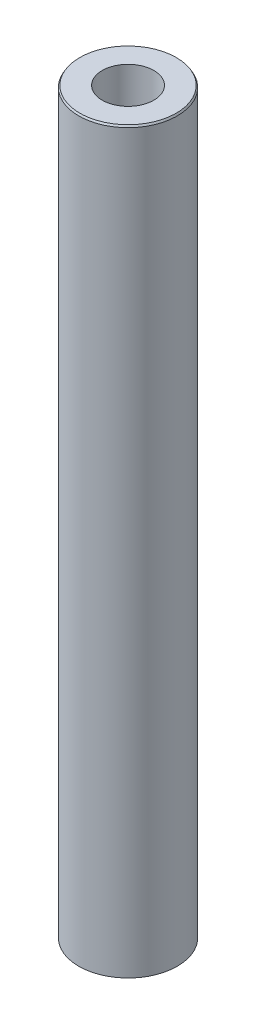
from build123d import *
from OCP.BRepFilletAPI import BRepFilletAPI_MakeChamfer

# Parameters (mm, degrees)
SKETCH1_R           = 40
BOSS_EXTRUDE1_DEPTH = 600
SKETCH2_R           = 20.935503309
CUT_EXTRUDE1_DEPTH  = 603.660766933
CHAMFER1_SIZE       = 1.475150673
CHAMFER1_SIZE2      = 0.851678638


with BuildPart() as part:
    # Sketch1 → Boss-Extrude1 (new body)
    with BuildSketch(Plane(origin=(0, 0, 0), x_dir=(1, 0, 0), z_dir=(0, 1, 0))):
        Circle(SKETCH1_R)
    extrude(amount=BOSS_EXTRUDE1_DEPTH)

    # Sketch2 → Cut-Extrude1 (cut, through all)
    with BuildSketch(Plane(origin=(0, 0, 0), x_dir=(1, 0, 0), z_dir=(0, 1, 0))):
        Circle(SKETCH2_R)
    extrude(amount=CUT_EXTRUDE1_DEPTH, mode=Mode.SUBTRACT)

    # Chamfer1: one chamfer whose edges measure the first distance from different faces: ONE call of the kernel's chamfer builder (chamfer() names one face for all edges)
    chamfer1_edges_1 = [part.edges().sort_by_distance(p)[0] for p in [
        (-40, 600, 0),
    ]]
    chamfer1_side_1 = [part.faces().sort_by_distance(p)[0] for p in [
        (-40, 300, 0),
    ]]
    chamfer1_edges_2 = [part.edges().sort_by_distance(p)[0] for p in [
        (-40, 0, 0),
    ]]
    chamfer1_side_2 = [part.faces().sort_by_distance(p)[0] for p in [
        (-38.86862915, 0, 0),
    ]]
    chamfer1 = BRepFilletAPI_MakeChamfer(part.part.solid().wrapped)
    for e in chamfer1_edges_1:
        chamfer1.Add(CHAMFER1_SIZE, CHAMFER1_SIZE2, e.wrapped, chamfer1_side_1[0].wrapped)  # the first distance lies on this face
    for e in chamfer1_edges_2:
        chamfer1.Add(CHAMFER1_SIZE, CHAMFER1_SIZE2, e.wrapped, chamfer1_side_2[0].wrapped)  # the first distance lies on this face
    add(Compound.cast(chamfer1.Shape()), mode=Mode.REPLACE)


solid = part.part
